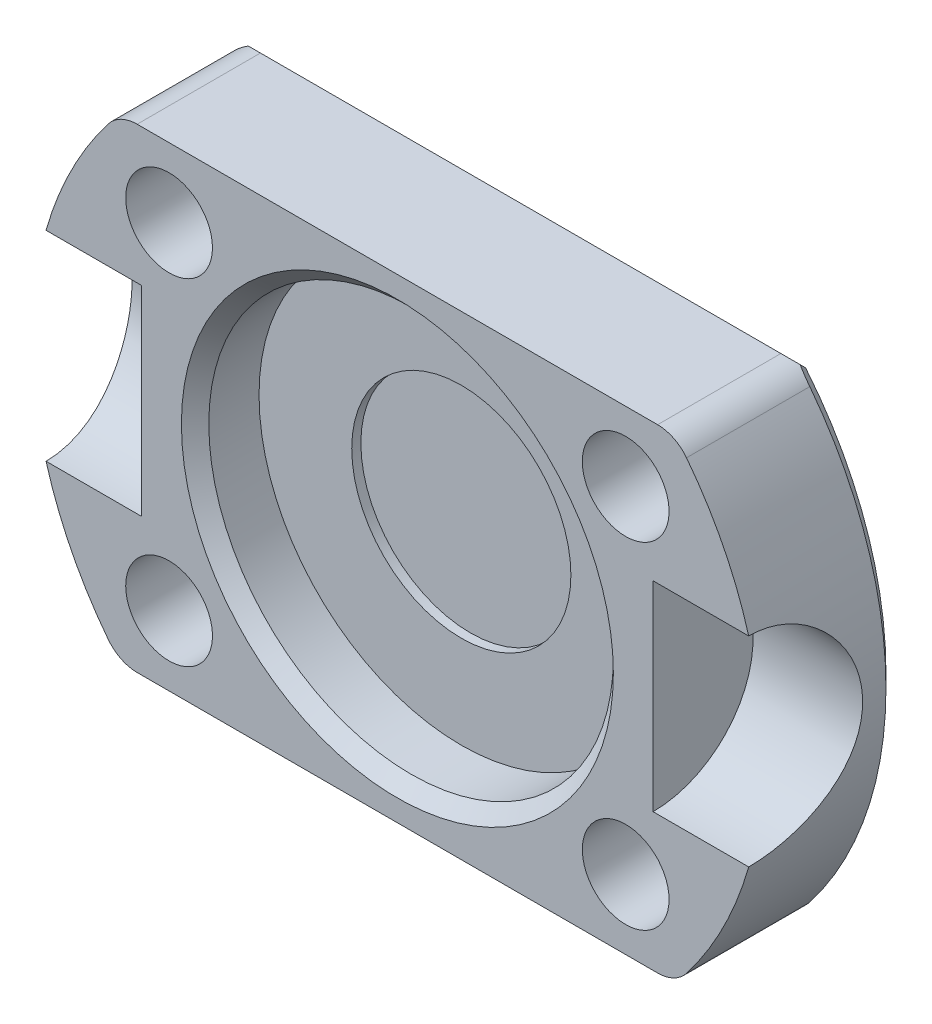
from build123d import *

# Parameters (mm, degrees)
AUFSATZ_LINEAR_AUSTRAGEN1_DEPTH = 7.5
SKIZZE2_R                       = 11.075
SCHNITT_LINEAR_AUSTRAGEN1_DEPTH = 3.5
SKIZZE3_R                       = 5.475
SCHNITT_LINEAR_AUSTRAGEN2_DEPTH = 38.165171868
SKIZZE4_R                       = 2.375
SCHNITT_LINEAR_AUSTRAGEN3_DEPTH = 6
FASE1_SIZE                      = 0.75
VERRUNDUNG1_R                   = 2
SKIZZE5_R                       = 6
SCHNITT_LINEAR_AUSTRAGEN4_DEPTH = 0.5


with BuildPart() as part:
    # Skizze1 → Aufsatz-Linear austragen1 (new body)
    with BuildSketch(Plane.XY):
        with BuildLine():
            Line((-15.198684154, 13), (15.198684154, 13))
            ThreePointArc((15.198684154, 13), (20, 0), (15.198684154, -13))
            Line((15.198684154, -13), (-15.198684154, -13))
            ThreePointArc((-15.198684154, -13), (-20, 0), (-15.198684154, 13))
        make_face()
    extrude(amount=AUFSATZ_LINEAR_AUSTRAGEN1_DEPTH)

    # Skizze2 → Schnitt-Linear austragen1 (cut)
    with BuildSketch(Plane.XY.offset(7.5)):
        Circle(SKIZZE2_R)
    extrude(amount=-SCHNITT_LINEAR_AUSTRAGEN1_DEPTH, mode=Mode.SUBTRACT)

    # Skizze3 → Schnitt-Linear austragen2 (cut, through all)
    with BuildSketch(Plane(origin=(14, 0, 0), x_dir=(0, 0, -1), z_dir=(1, 0, 0))):
        with Locations((-7.5, 0)):
            Circle(SKIZZE3_R)
    schnitt_linear_austragen2 = extrude(amount=SCHNITT_LINEAR_AUSTRAGEN2_DEPTH, mode=Mode.SUBTRACT)

    # Spiegeln1: Schnitt-Linear austragen2 across plane
    add(schnitt_linear_austragen2.mirror(Plane(origin=(0, 0, 0), x_dir=(0, 0, 1), z_dir=(1, 0, 0))), mode=Mode.SUBTRACT)

    # Skizze4 → Schnitt-Linear austragen3 (cut)
    with BuildSketch(Plane.XY.offset(7.5)):
        with Locations((-12.5, 9.2)):
            Circle(SKIZZE4_R)
        with Locations((12.5, 9.2)):
            Circle(SKIZZE4_R)
        with Locations((12.5, -9.2)):
            Circle(SKIZZE4_R)
        with Locations((-12.5, -9.2)):
            Circle(SKIZZE4_R)
    extrude(amount=-SCHNITT_LINEAR_AUSTRAGEN3_DEPTH, mode=Mode.SUBTRACT)

    # Fase1
    fase1_edges = [part.edges().sort_by_distance(p)[0] for p in [
        (0, -13, 0),
        (20, 0, 0),
        (0, 13, 0),
        (-20, 0, 0),
        (-11.075, 0, 7.5),
    ]]
    chamfer(fase1_edges, length=FASE1_SIZE)

    # Verrundung1
    verrundung1_edges = [part.edges().sort_by_distance(p)[0] for p in [
        (-15.198684154, -13, 4.125),
        (15.198684154, -13, 4.125),
        (15.198684154, 13, 4.125),
        (-15.198684154, 13, 4.125),
    ]]
    fillet(verrundung1_edges, radius=VERRUNDUNG1_R)

    # Skizze5 → Schnitt-Linear austragen4 (cut)
    with BuildSketch(Plane.XY.offset(4)):
        Circle(SKIZZE5_R)
    extrude(amount=-SCHNITT_LINEAR_AUSTRAGEN4_DEPTH, mode=Mode.SUBTRACT)


solid = part.part
